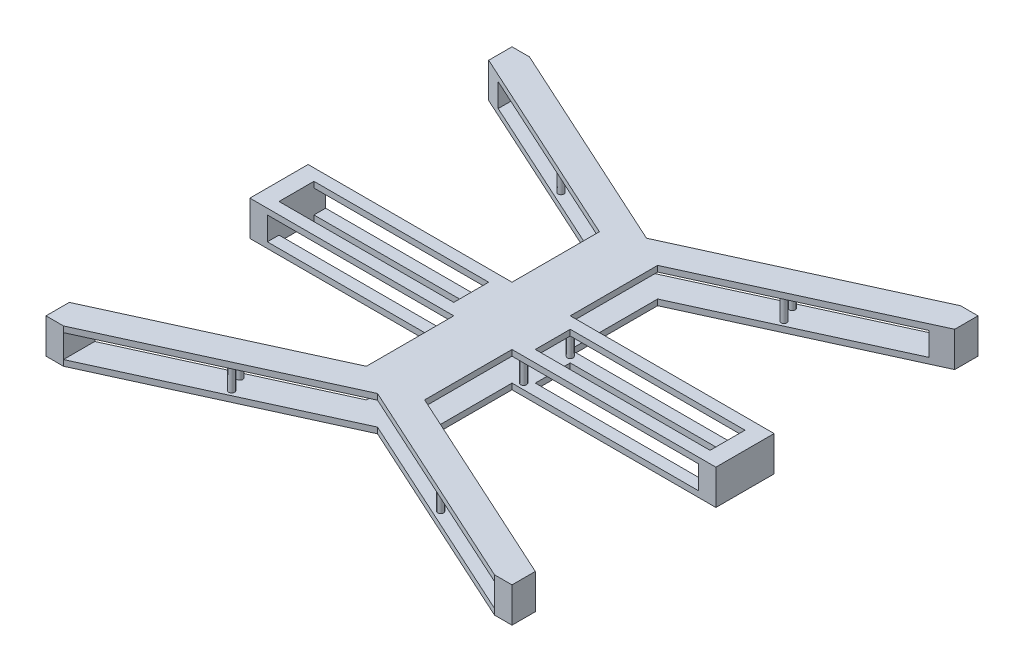
from build123d import *

# Parameters (mm, degrees)
BOSS_EXTRUDE1_DEPTH      = 12
BOSS_EXTRUDE1_DEPTH_BACK = 12
SKETCH2_W                = 296
SKETCH2_H                = 16
CUT_EXTRUDE1_DEPTH       = 320
SKETCH4_W                = 120
SKETCH4_H                = 24
CUT_EXTRUDE2_DEPTH       = 24
SKETCH5_R                = 2
BOSS_EXTRUDE2_DEPTH      = 16


with BuildPart() as part:
    # Sketch1 → Boss-Extrude1 (new, two sides: drawn at the far end of the back side and taken through both)
    with BuildSketch(Plane(origin=(0, 0, 0), x_dir=(1, 0, 0), z_dir=(0, 1, 0)).offset(-BOSS_EXTRUDE1_DEPTH_BACK)):
        Polygon((160, 20), (160, -20), (20, -20), (20, -80), (160, -144), (160, -160), (148, -160), (0, -92.342857143), (-148, -160), (-160, -160), (-160, -144), (-20, -80), (-20, -20), (-160, -20), (-160, 20), (-20, 20), (-20, 80), (-160, 144), (-160, 160), (-148, 160), (0, 92.342857143), (148, 160), (160, 160), (160, 144), (20, 80), (20, 20), align=None)
    extrude(amount=BOSS_EXTRUDE1_DEPTH + BOSS_EXTRUDE1_DEPTH_BACK)

    # Sketch2 → Cut-Extrude1 (cut)
    with BuildSketch(Plane.XY.offset(160)):
        Rectangle(SKETCH2_W, SKETCH2_H)
    extrude(amount=-CUT_EXTRUDE1_DEPTH, mode=Mode.SUBTRACT)

    # Sketch4 → Cut-Extrude2 (cut)
    with BuildSketch(Plane(origin=(0, 12, 0), x_dir=(1, 0, 0), z_dir=(0, 1, 0))):
        with Locations((-88, 0)):
            Rectangle(SKETCH4_W, SKETCH4_H)
        with Locations((88, 0)):
            Rectangle(SKETCH4_W, SKETCH4_H)
    extrude(amount=-CUT_EXTRUDE2_DEPTH, mode=Mode.SUBTRACT)

    # Sketch5 → Boss-Extrude2 (add)
    with BuildSketch(Plane(origin=(0, -8, 0), x_dir=(1, 0, 0), z_dir=(0, 1, 0))):
        with Locations((-71.7451651, -120.742502582)):
            Circle(SKETCH5_R)
        with Locations((-76.543327396, -110.246522559)):
            Circle(SKETCH5_R)
        with Locations((-24, -16)):
            Circle(SKETCH5_R)
        with Locations((0, -80.342857143)):
            Circle(SKETCH5_R)
        with Locations((24, -16)):
            Circle(SKETCH5_R)
        with Locations((71.7451651, -120.742502582)):
            Circle(SKETCH5_R)
        with Locations((76.543327396, -110.246522559)):
            Circle(SKETCH5_R)
        with Locations((76.543327396, 110.246522559)):
            Circle(SKETCH5_R)
        with Locations((71.7451651, 120.742502582)):
            Circle(SKETCH5_R)
        with Locations((-71.7451651, 120.742502582)):
            Circle(SKETCH5_R)
        with Locations((-76.543327396, 110.246522559)):
            Circle(SKETCH5_R)
        with Locations((0, 80.342857143)):
            Circle(SKETCH5_R)
        with Locations((24, 16)):
            Circle(SKETCH5_R)
        with Locations((-24, 16)):
            Circle(SKETCH5_R)
    extrude(amount=BOSS_EXTRUDE2_DEPTH)


solid = part.part
